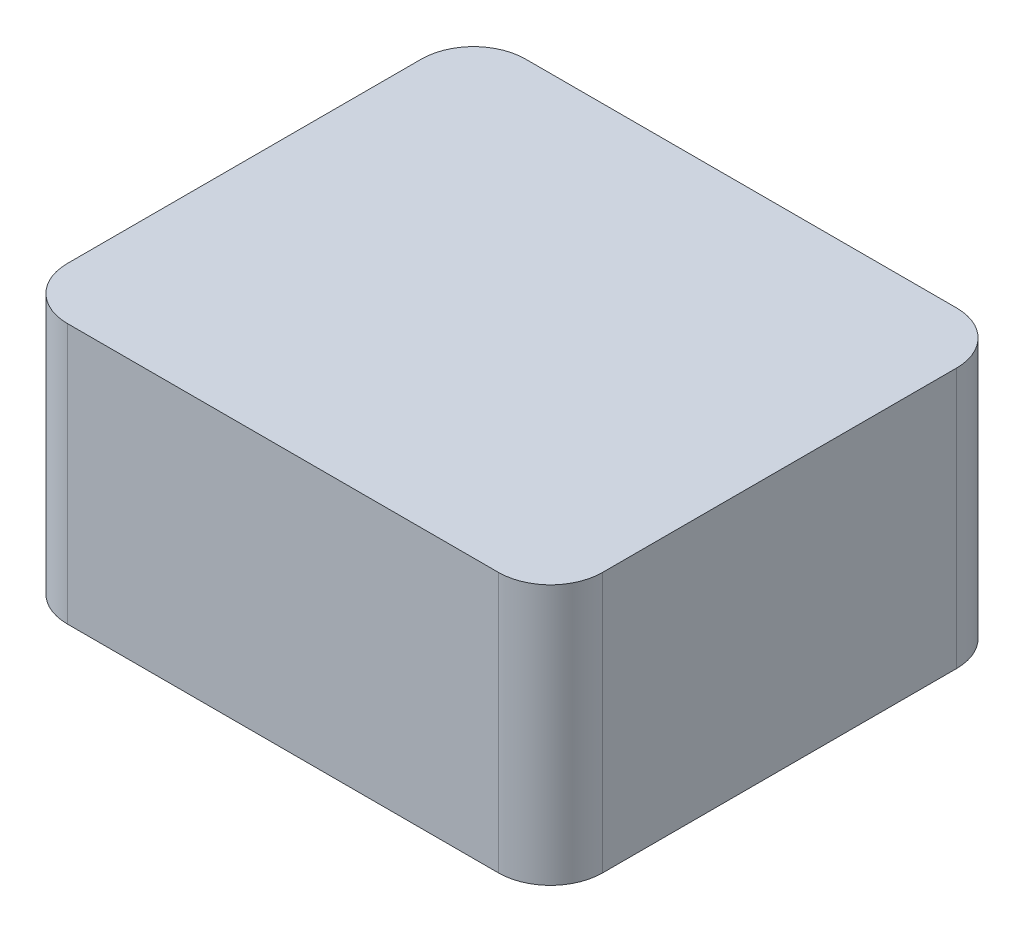
from build123d import *

# Parameters (mm, degrees)
SKETCH1_W           = 13.0556
SKETCH1_H           = 11.176
BOSS_EXTRUDE1_DEPTH = 6.35
FILLET1_R           = 1.27


with BuildPart() as part:
    # Sketch1 → Boss-Extrude1 (new body)
    with BuildSketch(Plane(origin=(0, 0, 0), x_dir=(1, 0, 0), z_dir=(0, 1, 0))):
        Rectangle(SKETCH1_W, SKETCH1_H)
    extrude(amount=BOSS_EXTRUDE1_DEPTH)

    # Fillet1
    fillet1_edges = [part.edges().sort_by_distance(p)[0] for p in [
        (6.5278, 3.175, 5.588),
        (6.5278, 3.175, -5.588),
        (-6.5278, 3.175, -5.588),
        (-6.5278, 3.175, 5.588),
    ]]
    fillet(fillet1_edges, radius=FILLET1_R)


solid = part.part
